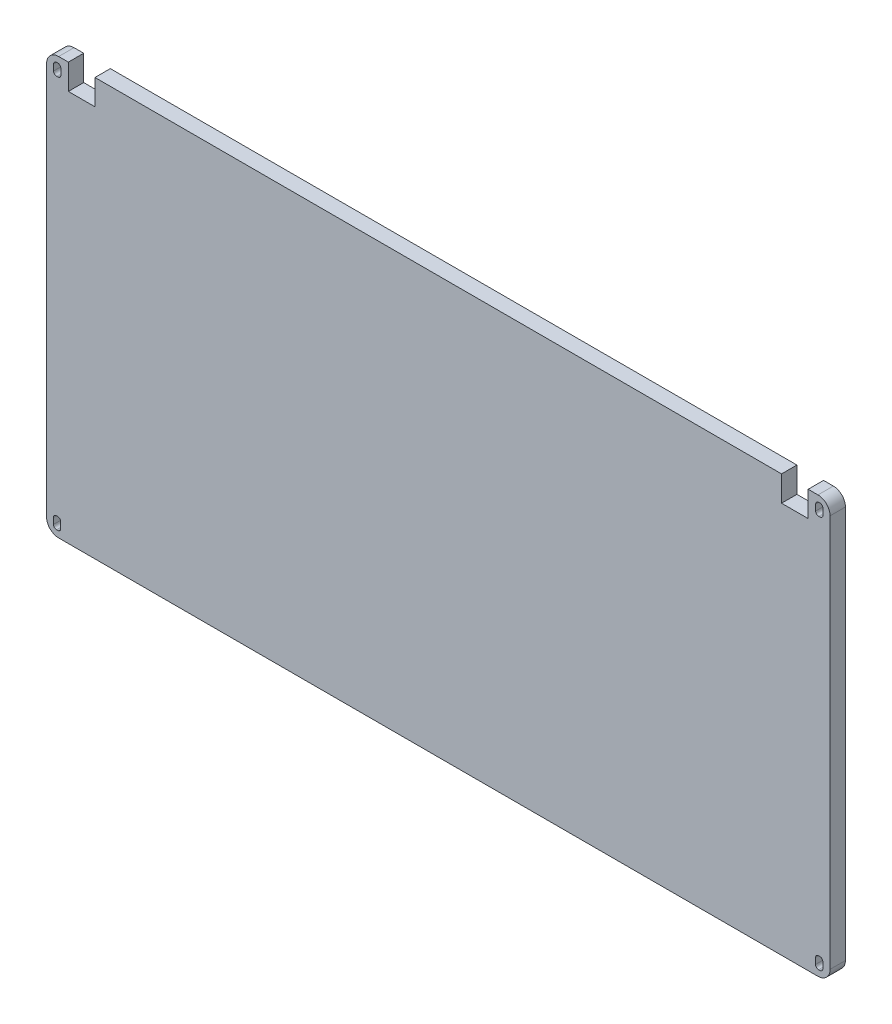
from build123d import *

# Parameters (mm, degrees)
BOSS_EXTRUDE1_DEPTH = 12.7
FILLET1_R           = 10


with BuildPart() as part:
    # Sketch1 → Boss-Extrude1 (new body)
    with BuildSketch(Plane.XY):
        Polygon((307.625143269, 169.700104384), (325.725145069, 169.700104384), (325.725145069, -174.977895616), (-321.974854931, -174.977895616), (-321.974854931, 169.700104384), (-303.974854931, 169.700104384), (-303.974854931, 148.700104384), (-281.974854931, 148.700104384), (-281.974854931, 169.700104384), (285.625143269, 169.700104384), (285.625143269, 148.700104384), (307.625143269, 148.700104384), align=None)
        with BuildLine():
            Line((317.221591679, -169.977895616), (316.221591679, -169.977895616))
            ThreePointArc((316.221591679, -169.977895616), (314.453824726, -169.245662569), (313.721591679, -167.477895616))
            Line((313.721591679, -167.477895616), (313.721591679, -162.477895616))
            ThreePointArc((313.721591679, -162.477895616), (314.453824726, -160.710128663), (316.221591679, -159.977895616))
            Line((316.221591679, -159.977895616), (317.221591679, -159.977895616))
            ThreePointArc((317.221591679, -159.977895616), (318.989358632, -160.710128663), (319.721591679, -162.477895616))
            Line((319.721591679, -162.477895616), (319.721591679, -167.477895616))
            ThreePointArc((319.721591679, -167.477895616), (318.989358632, -169.245662569), (317.221591679, -169.977895616))
        make_face(mode=Mode.SUBTRACT)
        with BuildLine():
            Line((-312.778408321, -169.977895616), (-313.778408321, -169.977895616))
            ThreePointArc((-313.778408321, -169.977895616), (-315.546175274, -169.245662569), (-316.278408321, -167.477895616))
            Line((-316.278408321, -167.477895616), (-316.278408321, -162.477895616))
            ThreePointArc((-316.278408321, -162.477895616), (-315.546175274, -160.710128663), (-313.778408321, -159.977895616))
            Line((-313.778408321, -159.977895616), (-312.778408321, -159.977895616))
            ThreePointArc((-312.778408321, -159.977895616), (-311.010641368, -160.710128663), (-310.278408321, -162.477895616))
            Line((-310.278408321, -162.477895616), (-310.278408321, -167.477895616))
            ThreePointArc((-310.278408321, -167.477895616), (-311.010641368, -169.245662569), (-312.778408321, -169.977895616))
        make_face(mode=Mode.SUBTRACT)
        with BuildLine():
            Line((-312.674854931, 154.702104384), (-313.674854931, 154.702104384))
            ThreePointArc((-313.674854931, 154.702104384), (-315.442621884, 155.434337431), (-316.174854931, 157.202104384))
            Line((-316.174854931, 157.202104384), (-316.174854931, 162.202104384))
            ThreePointArc((-316.174854931, 162.202104384), (-315.442621884, 163.969871337), (-313.674854931, 164.702104384))
            Line((-313.674854931, 164.702104384), (-312.674854931, 164.702104384))
            ThreePointArc((-312.674854931, 164.702104384), (-310.907087978, 163.969871337), (-310.174854931, 162.202104384))
            Line((-310.174854931, 162.202104384), (-310.174854931, 157.202104384))
            ThreePointArc((-310.174854931, 157.202104384), (-310.907087978, 155.434337431), (-312.674854931, 154.702104384))
        make_face(mode=Mode.SUBTRACT)
        with BuildLine():
            Line((317.325145069, 154.702104384), (316.325145069, 154.702104384))
            ThreePointArc((316.325145069, 154.702104384), (314.557378116, 155.434337431), (313.825145069, 157.202104384))
            Line((313.825145069, 157.202104384), (313.825145069, 162.202104384))
            ThreePointArc((313.825145069, 162.202104384), (314.557378116, 163.969871337), (316.325145069, 164.702104384))
            Line((316.325145069, 164.702104384), (317.325145069, 164.702104384))
            ThreePointArc((317.325145069, 164.702104384), (319.092912022, 163.969871337), (319.825145069, 162.202104384))
            Line((319.825145069, 162.202104384), (319.825145069, 157.202104384))
            ThreePointArc((319.825145069, 157.202104384), (319.092912022, 155.434337431), (317.325145069, 154.702104384))
        make_face(mode=Mode.SUBTRACT)
    extrude(amount=BOSS_EXTRUDE1_DEPTH)

    # Fillet1
    fillet1_edges = [part.edges().sort_by_distance(p)[0] for p in [
        (-321.974854931, -174.977895616, 6.35),
        (-321.974854931, 169.700104384, 6.35),
        (325.725145069, -174.977895616, 6.35),
        (325.725145069, 169.700104384, 6.35),
    ]]
    fillet(fillet1_edges, radius=FILLET1_R)


solid = part.part
